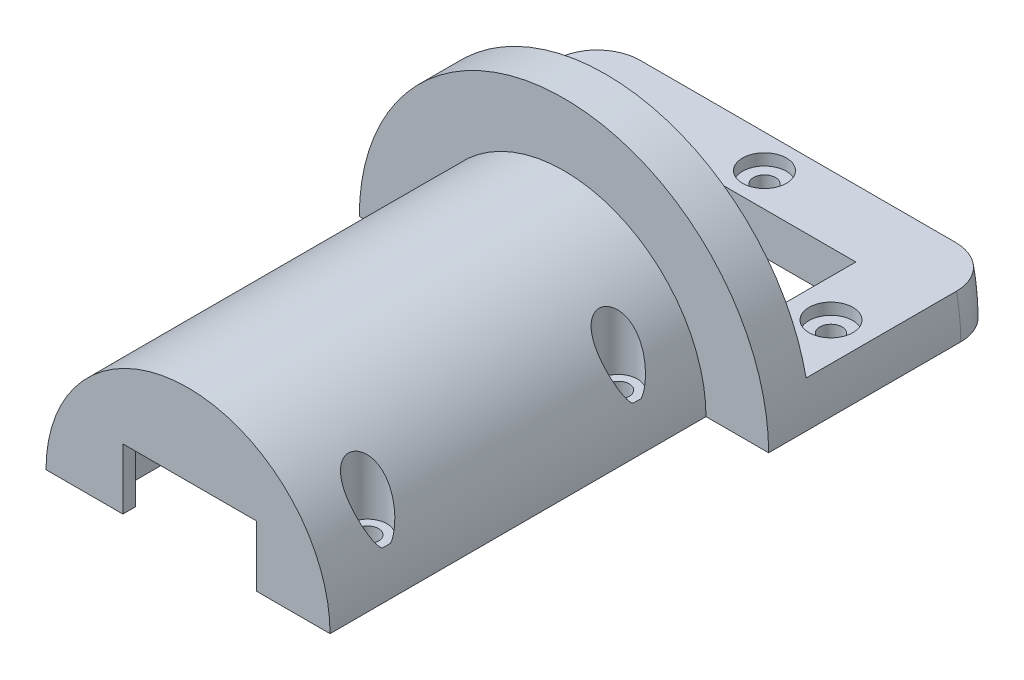
from build123d import *
from build123d.topology import SkipClean

# Parameters (mm, degrees)
ESQUISSE2_R                                      = 31.5
ESQUISSE2_W                                      = 32
ESQUISSE2_H                                      = 32
BOSS_EXTRU_1_DEPTH                               = 3
BOSS_EXTRU_2_START                               = -100
ESQUISSE4_R                                      = 35
ESQUISSE4_R_2                                    = 31.5
BOSS_EXTRU_2_DEPTH                               = 100
BOSS_EXTRU_3_OUTLINE_R                           = 31.5
BOSS_EXTRU_3_OUTLINE_W                           = 43
BOSS_EXTRU_3_OUTLINE_H                           = 42.5
BOSS_EXTRU_3_DEPTH                               = 97
ESQUISSE6_R                                      = 31.5
ENL_V_MAT_EXTRU_1_DEPTH                          = 10
ESQUISSE7_R                                      = 49
ESQUISSE7_R_2                                    = 35
BOSS_EXTRU_4_DEPTH                               = 10
BOSS_EXTRU_5_START                               = 30
BOSS_EXTRU_5_DEPTH                               = 30
BOSS_EXTRU_6_START                               = 16
BOSS_EXTRU_6_DEPTH                               = 16
CONG_1_R                                         = 10
ESQUISSE11_W                                     = 137.068824
ESQUISSE11_H                                     = 50.889867
ENL_V_MAT_EXTRU_2_DEPTH                          = 153
CHAMBRAGE_POUR_VIS_T_TE_RONDE_6_PANS_D           = 5.3
CHAMBRAGE_POUR_VIS_T_TE_RONDE_6_PANS_DEPTH       = 18
CHAMBRAGE_POUR_VIS_T_TE_RONDE_6_PANS_CBORE_D     = 10.5
CHAMBRAGE_POUR_VIS_T_TE_RONDE_6_PANS_CBORE_DEPTH = 2.75
CHAMBRAGE_POUR_VIS_T_TE_RONDE_6_PANS_TIP         = 1.592281
ESQUISSE18_R                                     = 2.6
ENL_V_MAT_EXTRU_4_DEPTH                          = 25
ESQUISSE19_R                                     = 4.6
ENL_V_MAT_EXTRU_5_DEPTH                          = 25
ESQUISSE20_W                                     = 2
ESQUISSE20_H                                     = 3
ENL_V_MAT_EXTRU_6_DEPTH                          = 45
ENL_V_START                                      = -90
ENL_V_MAT_EXTRU_7_DEPTH                          = 90


# Read off the part's stored shape, not the designer's step: Boss.-Extru.3
with BuildPart() as part:
    # Esquisse2 → Boss.-Extru.1 (new body)
    with BuildSketch(Plane.XY):
        Circle(ESQUISSE2_R)
        with Locations((0.409228, -1.432297)):
            Rectangle(ESQUISSE2_W, ESQUISSE2_H, mode=Mode.SUBTRACT)
    extrude(amount=BOSS_EXTRU_1_DEPTH)

    # Esquisse4 → Boss.-Extru.2 (add)
    with BuildSketch(Plane.XY.offset(3).offset(BOSS_EXTRU_2_START)):
        Circle(ESQUISSE4_R)
        Circle(ESQUISSE4_R_2, mode=Mode.SUBTRACT)
    extrude(amount=BOSS_EXTRU_2_DEPTH)

    # Boss.-Extru.3 outline → Boss.-Extru.3 (add)
    with BuildSketch(Plane(origin=(0, 0, 0), x_dir=(-1, 0, 0), z_dir=(0, 0, -1))):
        Circle(BOSS_EXTRU_3_OUTLINE_R)
        with Locations((-0.409228, -1.182297)):
            Rectangle(BOSS_EXTRU_3_OUTLINE_W, BOSS_EXTRU_3_OUTLINE_H, mode=Mode.SUBTRACT)
    extrude(amount=BOSS_EXTRU_3_DEPTH)

    # Esquisse6 → Enlèv. mat.-Extru.1 (cut)
    with BuildSketch(Plane(origin=(0, 0, -97), x_dir=(-1, 0, 0), z_dir=(0, 0, -1))):
        Circle(ESQUISSE6_R)
    extrude(amount=-ENL_V_MAT_EXTRU_1_DEPTH, mode=Mode.SUBTRACT)

    # Esquisse7 → Boss.-Extru.4 (add)
    with BuildSketch(Plane(origin=(0, 0, -97), x_dir=(-1, 0, 0), z_dir=(0, 0, -1))):
        Circle(ESQUISSE7_R)
        with Locations(Location((0, 0, 0), (0, 0, 180))):
            Circle(ESQUISSE7_R_2, mode=Mode.SUBTRACT)
    extrude(amount=-BOSS_EXTRU_4_DEPTH)

    # Esquisse8 → Boss.-Extru.5 (add)
    with SkipClean():  # the faces are left unmerged after this step: merging them gives an invalid solid
        with BuildSketch(Plane(origin=(0, 0, -97), x_dir=(-1, 0, 0), z_dir=(0, 0, -1)).offset(BOSS_EXTRU_5_START)):
            with BuildLine():
                Line((-47.96874, 10), (-29.870554, 10))
                ThreePointArc((-29.870554, 10), (-31.5, 0), (-29.870554, -10))
                Line((-29.870554, -10), (-47.96874, -10))
                ThreePointArc((-47.96874, -10), (-49, 0), (-47.96874, 10))
            make_face()
            with BuildLine():
                Line((29.870554, 10), (47.96874, 10))
                ThreePointArc((47.96874, 10), (49, 0), (47.96874, -10))
                Line((47.96874, -10), (29.870554, -10))
                ThreePointArc((29.870554, -10), (31.5, 0), (29.870554, 10))
            make_face()
        extrude(amount=-BOSS_EXTRU_5_DEPTH)

    # Esquisse10 → Boss.-Extru.6 (add)
    with SkipClean():  # the faces are left unmerged after this step: merging them gives an invalid solid
        with BuildSketch(Plane(origin=(0, 0, -127), x_dir=(-1, 0, 0), z_dir=(0, 0, -1)).offset(BOSS_EXTRU_6_START)):
            with BuildLine():
                Line((47.96874, 10), (-47.96874, 10))
                ThreePointArc((-47.96874, 10), (-49, 0), (-47.96874, -10))
                Line((-47.96874, -10), (47.96874, -10))
                ThreePointArc((47.96874, -10), (49, 0), (47.96874, 10))
            make_face()
        extrude(amount=-BOSS_EXTRU_6_DEPTH)

    # Congé1
    cong_1_edges = [part.edges().sort_by_distance(p)[0] for p in [
        (-49, 0, -143),
        (49, 0, -143),
    ]]
    fillet(cong_1_edges, radius=CONG_1_R)

    # Esquisse11 → Enlèv. mat.-Extru.2 (cut)
    with SkipClean():  # the faces are left unmerged after this step: merging them gives an invalid solid
        with BuildSketch(Plane(origin=(0, 0, -143), x_dir=(-1, 0, 0), z_dir=(0, 0, -1))):
            with Locations((0, -25.444933)):
                Rectangle(ESQUISSE11_W, ESQUISSE11_H)
        extrude(amount=-ENL_V_MAT_EXTRU_2_DEPTH, mode=Mode.SUBTRACT)

    # Chambrage pour Vis à tête ronde à 6 pans creux M51
    with Locations(Plane(origin=(0, 10, 0), x_dir=(1, 0, 0), z_dir=(0, 1, 0))):
        with Locations((-38.919647, 112), (38.919647, 112), (0, 135)):
            CounterBoreHole(CHAMBRAGE_POUR_VIS_T_TE_RONDE_6_PANS_D / 2, CHAMBRAGE_POUR_VIS_T_TE_RONDE_6_PANS_CBORE_D / 2, CHAMBRAGE_POUR_VIS_T_TE_RONDE_6_PANS_CBORE_DEPTH, depth=CHAMBRAGE_POUR_VIS_T_TE_RONDE_6_PANS_DEPTH)
            with Locations((0, 0, -(CHAMBRAGE_POUR_VIS_T_TE_RONDE_6_PANS_DEPTH + CHAMBRAGE_POUR_VIS_T_TE_RONDE_6_PANS_TIP / 2))):  # 118° drill point
                Cone(0, CHAMBRAGE_POUR_VIS_T_TE_RONDE_6_PANS_D / 2, CHAMBRAGE_POUR_VIS_T_TE_RONDE_6_PANS_TIP, mode=Mode.SUBTRACT)

    # Esquisse18 → Enlèv. mat.-Extru.4 (cut, symmetric)
    with SkipClean():  # the faces are left unmerged after this step: merging them gives an invalid solid
        with BuildSketch(Plane(origin=(0, 15, 0), x_dir=(-1, 0, 0), z_dir=(0, -1, 0))):
            with Locations(Location((28, 12, 0), (0, 0, 90))):
                Circle(ESQUISSE18_R)
            with Locations(Location((-28, 12, 0), (0, 0, 90))):
                Circle(ESQUISSE18_R)
            with Locations(Location((28, 72, 0), (0, 0, 90))):
                Circle(ESQUISSE18_R)
            with Locations(Location((-28, 72, 0), (0, 0, 90))):
                Circle(ESQUISSE18_R)
        extrude(amount=ENL_V_MAT_EXTRU_4_DEPTH, both=True, mode=Mode.SUBTRACT)

    # Esquisse19 → Enlèv. mat.-Extru.5 (cut)
    with SkipClean():  # the faces are left unmerged after this step: merging them gives an invalid solid
        with BuildSketch(Plane.ZX.offset(35)):
            with Locations((-72, 28)):
                Circle(ESQUISSE19_R)
            with Locations((-12, 28)):
                Circle(ESQUISSE19_R)
            with Locations((-12, -28)):
                Circle(ESQUISSE19_R)
            with Locations((-72, -28)):
                Circle(ESQUISSE19_R)
        extrude(amount=-ENL_V_MAT_EXTRU_5_DEPTH, mode=Mode.SUBTRACT)

    # Esquisse20 → Enlèv. mat.-Extru.6 (cut)
    with SkipClean():  # the faces are left unmerged after this step: merging them gives an invalid solid
        with BuildSketch(Plane(origin=(0, 0, -87), x_dir=(-1, 0, 0), z_dir=(0, 0, -1))):
            with Locations((22.090772, 1.5)):
                Rectangle(ESQUISSE20_W, ESQUISSE20_H)
        extrude(amount=-ENL_V_MAT_EXTRU_6_DEPTH, mode=Mode.SUBTRACT)

    # Esquisse21 → Enlèv. mat.-Extru.7 (cut)
    with SkipClean():  # the faces are left unmerged after this step: merging them gives an invalid solid
        with BuildSketch(Plane.XY.offset(3).offset(ENL_V_START)):
            with BuildLine():
                Line((-35, 0), (-34, 0))
                ThreePointArc((-34, 0), (0, 34), (34, 0))
                Line((34, 0), (35, 0))
                ThreePointArc((35, 0), (0, 35), (-35, 0))
            make_face()
        extrude(amount=ENL_V_MAT_EXTRU_7_DEPTH, mode=Mode.SUBTRACT)


solid = part.part
